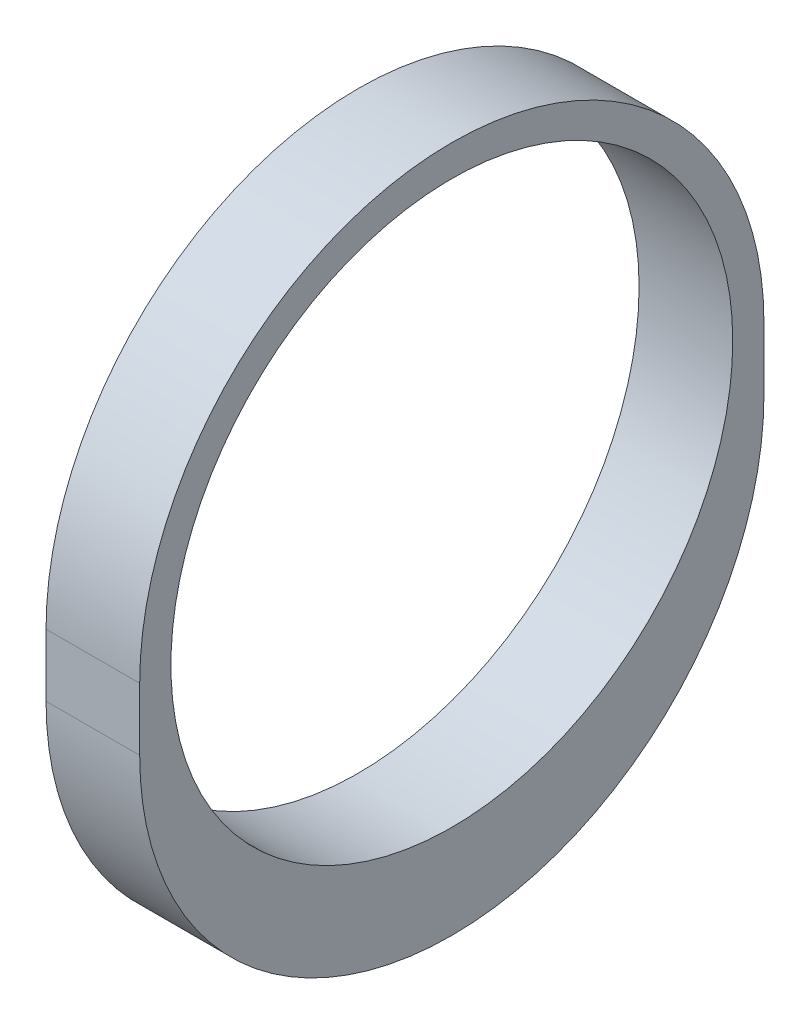
from build123d import *

# Parameters (mm, degrees)
SCHIZZO1_R                   = 9
ESTRUSIONE_ESTRUSIONE1_DEPTH = 1.5


with BuildPart() as part:
    # Schizzo1 → Estrusione-Estrusione1 (new, symmetric)
    with BuildSketch(Plane(origin=(0, 0, 0), x_dir=(0, 0, -1), z_dir=(1, 0, 0))):
        with BuildLine():
            Line((-10, 0), (-10, -2))
            ThreePointArc((-10, -2), (0, -12), (10, -2))
            Line((10, -2), (10, 0))
            ThreePointArc((10, 0), (0, 10), (-10, 0))
        make_face()
        Circle(SCHIZZO1_R, mode=Mode.SUBTRACT)
    extrude(amount=ESTRUSIONE_ESTRUSIONE1_DEPTH, both=True)


solid = part.part
